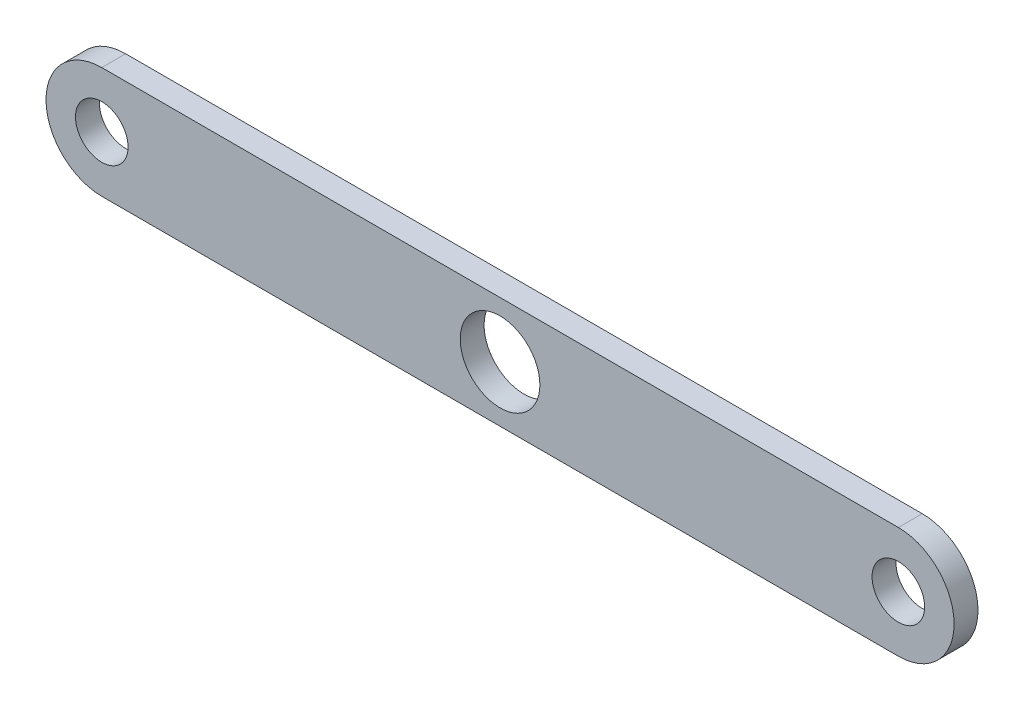
from build123d import *

# Parameters (mm, degrees)
SKETCH1_R           = 2.5
SKETCH1_R_2         = 1.65
BOSS_EXTRUDE1_DEPTH = 1.5


with BuildPart() as part:
    # Sketch1 → Boss-Extrude1 (new body)
    with BuildSketch(Plane.XY):
        with BuildLine():
            Line((-32.47323594, 3.489461585), (17.52676406, 3.489461585))
            ThreePointArc((17.52676406, 3.489461585), (21.02676406, -0.010538415), (17.52676406, -3.510538415))
            Line((17.52676406, -3.510538415), (-32.47323594, -3.510538415))
            ThreePointArc((-32.47323594, -3.510538415), (-35.97323594, -0.010538415), (-32.47323594, 3.489461585))
        make_face()
        with Locations((-7.47323594, -0.010538415)):
            Circle(SKETCH1_R, mode=Mode.SUBTRACT)
        with Locations((17.52676406, -0.010538415)):
            Circle(SKETCH1_R_2, mode=Mode.SUBTRACT)
        with Locations((-32.47323594, -0.010538415)):
            Circle(SKETCH1_R_2, mode=Mode.SUBTRACT)
    extrude(amount=BOSS_EXTRUDE1_DEPTH)


solid = part.part
